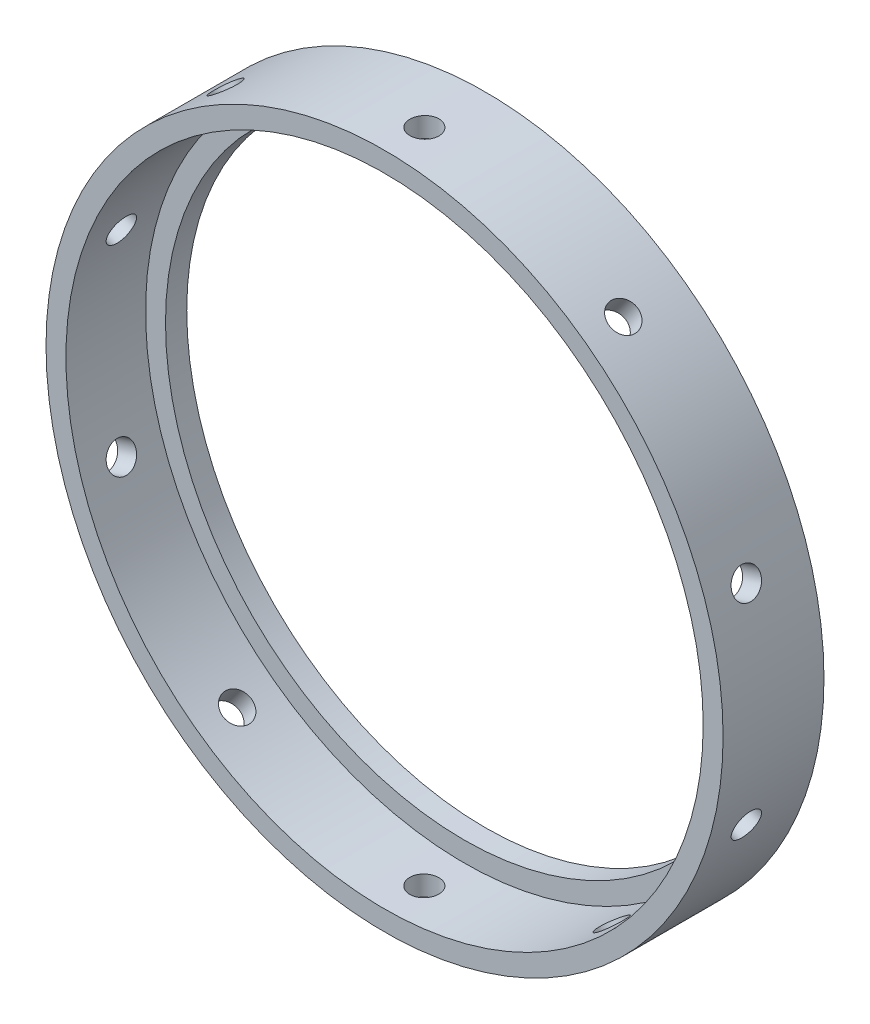
from build123d import *

# Parameters (mm, degrees)
SKETCH1_R           = 80.9625
SKETCH1_R_2         = 76.2
BOSS_EXTRUDE1_DEPTH = 19.05
SKETCH2_R           = 3.478244762
CUT_EXTRUDE1_DEPTH  = 117.072198706
CIRPATTERN1_COUNT   = 10
BOSS_EXTRUDE2_START = 5.08
SKETCH3_R           = 80.9625
SKETCH3_R_2         = 71.4375
BOSS_EXTRUDE2_DEPTH = 5.08


with BuildPart() as part:
    # Sketch1 → Boss-Extrude1 (new body)
    with BuildSketch(Plane.XY):
        Circle(SKETCH1_R)
        Circle(SKETCH1_R_2, mode=Mode.SUBTRACT)
    extrude(amount=BOSS_EXTRUDE1_DEPTH)

    # Sketch2 → Cut-Extrude1 (cut, through all)
    with BuildSketch(Plane(origin=(0, 0, 0), x_dir=(1, 0, 0), z_dir=(0, 1, 0))):
        with Locations((0, -9.525)):
            Circle(SKETCH2_R)
    cut_extrude1 = extrude(amount=-CUT_EXTRUDE1_DEPTH, mode=Mode.SUBTRACT)

    # CirPattern1: Cut-Extrude1 ×10 about axis
    cirpattern1_axis = Axis((0, 0, 2.080715754), (0, 0, 1))
    for i in range(1, CIRPATTERN1_COUNT):
        add(cut_extrude1.rotate(cirpattern1_axis, i * 360 / CIRPATTERN1_COUNT), mode=Mode.SUBTRACT)

    # Sketch3 → Boss-Extrude2 (add)
    with BuildSketch(Plane(origin=(0, 0, 0), x_dir=(-1, 0, 0), z_dir=(0, 0, -1)).offset(BOSS_EXTRUDE2_START)):
        Circle(SKETCH3_R)
        Circle(SKETCH3_R_2, mode=Mode.SUBTRACT)
    extrude(amount=-BOSS_EXTRUDE2_DEPTH)


solid = part.part
